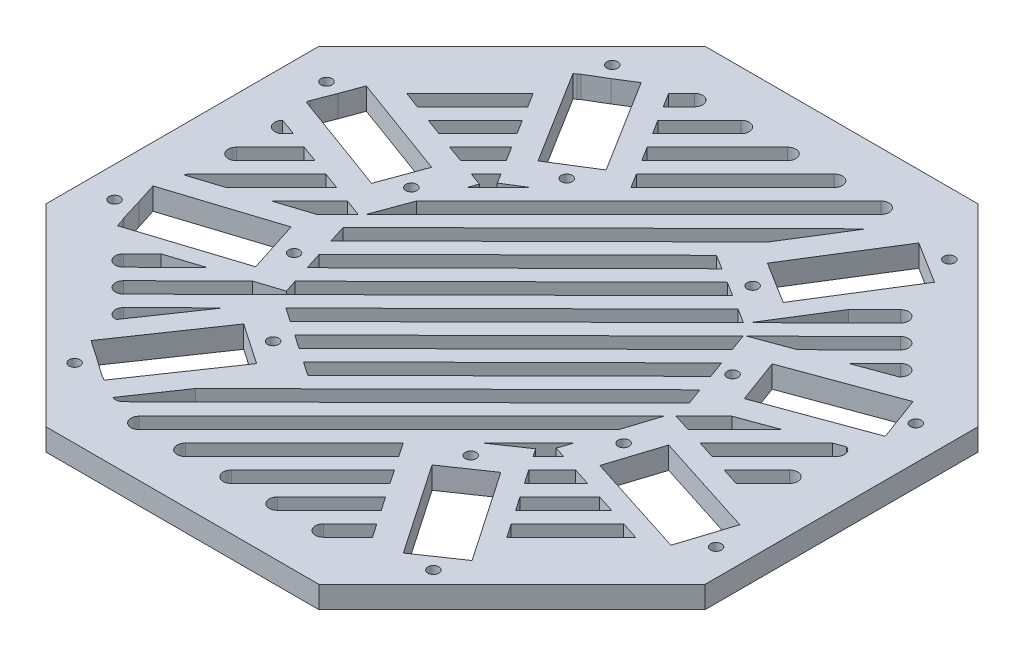
from build123d import *

# Parameters (mm, degrees)
SKETCH_R            = 1
BOSS_EXTRUDE2_DEPTH = 4
BOSS_EXTRUDE3_DEPTH = 4
BOSS_EXTRUDE4_DEPTH = 4
BOSS_EXTRUDE5_DEPTH = 4


with BuildPart() as part:
    # Sketch → Boss-Extrude2 (new body)
    with BuildSketch(Plane(origin=(0, 0, 0), x_dir=(1, 0, 0), z_dir=(0, 1, 0))):
        Polygon((24.852813742, -60), (60, -24.852813742), (60, 24.852813742), (24.852813742, 60), (-24.852813742, 60), (-60, 24.852813742), (-60, -24.852813742), (-24.852813742, -60), align=None)
        with BuildLine():
            ThreePointArc((15.547632792, 51.610078632), (17.668953135, 51.610078632), (17.668953135, 49.488758289))
            Line((17.668953135, 49.488758289), (-29.181889622, 2.637915532))
            Line((-29.181889622, 2.637915532), (-26.726613217, 9.335832623))
            Line((-26.726613217, 9.335832623), (15.547632792, 51.610078632))
        make_face(mode=Mode.SUBTRACT)
        Polygon((-18.457469949, 21.847616579), (-24.271336813, 16.033749714), (-23.651997277, 17.723288562), (-25.973454736, 18.574272479), (-23.289921125, 21.25780609), (-22.199833785, 19.511517433), align=None, mode=Mode.SUBTRACT)
        with BuildLine():
            Line((9.183671761, 49.488758289), (-9.321050806, 30.984035722))
            Line((-9.321050806, 30.984035722), (-10.951599402, 33.596127812))
            Line((-10.951599402, 33.596127812), (7.062351417, 51.610078632))
            ThreePointArc((7.062351417, 51.610078632), (9.183671761, 51.610078632), (9.183671761, 49.488758289))
        make_face(mode=Mode.SUBTRACT)
        with BuildLine():
            Line((0.698390387, 49.488758289), (-12.582147999, 36.208219903))
            Line((-12.582147999, 36.208219903), (-14.212696595, 38.820311994))
            Line((-14.212696595, 38.820311994), (-1.422929957, 51.610078632))
            ThreePointArc((-1.422929957, 51.610078632), (0.698390387, 51.610078632), (0.698390387, 49.488758289))
        make_face(mode=Mode.SUBTRACT)
        with BuildLine():
            Line((-7.786890987, 49.488758289), (-18.746379715, 38.529269561))
            Line((-18.746379715, 38.529269561), (-14.349223836, 31.485151945))
            Line((-14.349223836, 31.485151945), (-21.98384641, 26.719384625))
            Line((-21.98384641, 26.719384625), (-32.574440455, 43.685212567))
            Line((-32.574440455, 43.685212567), (-32.145121214, 43.953206903))
            Line((-32.145121214, 43.953206903), (-31.759627251, 44.281125154))
            Line((-31.759627251, 44.281125154), (-28.330410334, 46.33446731))
            Line((-28.330410334, 46.33446731), (-24.939817881, 48.450979888))
            Line((-24.939817881, 48.450979888), (-20.376928311, 41.141361652))
            Line((-20.376928311, 41.141361652), (-9.908211331, 51.610078632))
            ThreePointArc((-9.908211331, 51.610078632), (-7.786890987, 51.610078632), (-7.786890987, 49.488758289))
        make_face(mode=Mode.SUBTRACT)
        with BuildLine():
            Line((-16.272172362, 49.488758289), (-19.104342385, 46.656588265))
            Line((-19.104342385, 46.656588265), (-20.734890981, 49.268680356))
            Line((-20.734890981, 49.268680356), (-18.393492705, 51.610078632))
            ThreePointArc((-18.393492705, 51.610078632), (-16.272172362, 51.610078632), (-16.272172362, 49.488758289))
        make_face(mode=Mode.SUBTRACT)
        with BuildLine():
            Line((-23.386884958, -49.297198938), (-17.265542524, -40.337796786))
            Line((-17.265542524, -40.337796786), (28.858580089, 5.368255674))
            Line((28.858580089, 5.368255674), (29.994252328, 2.270177395))
            Line((29.994252328, 2.270177395), (-21.732188811, -48.987414041))
            ThreePointArc((-21.732188811, -48.987414041), (-22.511981545, -49.396320284), (-23.386884958, -49.297198938))
        make_face(mode=Mode.SUBTRACT)
        with BuildLine():
            ThreePointArc((-15.920221348, -51.966319523), (-18.035989196, -51.966319523), (-18.035989196, -49.850551674))
            Line((-18.035989196, -49.850551674), (29.735518609, -2.079043869))
            Line((29.735518609, -2.079043869), (27.74095069, -8.305147485))
            Line((27.74095069, -8.305147485), (-15.920221348, -51.966319523))
        make_face(mode=Mode.SUBTRACT)
        with BuildLine():
            ThreePointArc((17.847543234, -52.154981783), (15.72622289, -52.154981783), (15.72622289, -50.033661439))
            Line((15.72622289, -50.033661439), (20.576321038, -45.183563292))
            Line((20.576321038, -45.183563292), (22.298428081, -47.704096936))
            Line((22.298428081, -47.704096936), (17.847543234, -52.154981783))
        make_face(mode=Mode.SUBTRACT)
        with Locations((-29.313955478, 10.994083497)):
            Circle(SKETCH_R, mode=Mode.SUBTRACT)
        with Locations((-16.577946016, 26.557394094)):
            Circle(SKETCH_R, mode=Mode.SUBTRACT)
        Polygon((-29.237090611, -1.51987861), (18.657229481, 45.940326216), (11.745261483, 34.867551704), (-28.210101751, -4.725655158), align=None, mode=Mode.SUBTRACT)
        Polygon((-29.909052339, 1.910752815), (-33.685692162, -1.865887009), (-39.928135193, -3.865689353), (-33.013636065, 3.048809775), align=None, mode=Mode.SUBTRACT)
        with Locations((-30.345718275, 48.612970419)):
            Circle(SKETCH_R, mode=Mode.SUBTRACT)
        Polygon((-44.600957094, 25.402614244), (-33.073212704, 36.930358634), (-31.442664107, 34.318266543), (-41.496373368, 24.264557283), align=None, mode=Mode.SUBTRACT)
        Polygon((-49.440228376, 22.916277755), (-30.662134393, 16.032733147), (-33.599204758, 8.02049723), (-52.377298741, 14.904041837), (-52.363635773, 14.941313985), (-52.260838429, 15.436862853), (-50.8158933, 19.163506953), align=None, mode=Mode.SUBTRACT)
        with Locations((-53.725477656, 19.942691487)):
            Circle(SKETCH_R, mode=Mode.SUBTRACT)
        with BuildLine():
            Line((-51.610078632, -7.062351417), (-39.222803518, 5.324923697))
            Line((-39.222803518, 5.324923697), (-36.118219791, 4.186866736))
            Line((-36.118219791, 4.186866736), (-46.170578225, -5.865491697))
            Line((-46.170578225, -5.865491697), (-51.997617193, -7.732216973))
            ThreePointArc((-51.997617193, -7.732216973), (-51.847791756, -7.371861282), (-51.610078632, -7.062351417))
        make_face(mode=Mode.SUBTRACT)
        with BuildLine():
            ThreePointArc((-49.488758289, -0.698390387), (-51.610078632, -0.698390387), (-51.610078632, 1.422929957))
            Line((-51.610078632, 1.422929957), (-45.43197097, 7.601037619))
            Line((-45.43197097, 7.601037619), (-42.327387244, 6.462980658))
            Line((-42.327387244, 6.462980658), (-49.488758289, -0.698390387))
        make_face(mode=Mode.SUBTRACT)
        with BuildLine():
            ThreePointArc((-49.488758289, 7.786890987), (-51.594538912, 7.771575675), (-51.640481608, 9.876910769))
            Line((-51.640481608, 9.876910769), (-48.536554697, 8.739094579))
            Line((-48.536554697, 8.739094579), (-49.488758289, 7.786890987))
        make_face(mode=Mode.SUBTRACT)
        Polygon((-53.09075613, -12.282653686), (-34.044240872, -6.18099354), (-30.998587022, -15.688093434), (-50.045102279, -21.78975358), (-50.499411202, -20.371614646), (-50.722662067, -19.917417524), (-51.871349514, -16.089068033), align=None, mode=Mode.SUBTRACT)
        with Locations((-54.424906493, -17.951452655)):
            Circle(SKETCH_R, mode=Mode.SUBTRACT)
        with BuildLine():
            Line((-40.814392402, -29.885895415), (-29.055540278, -18.233625808))
            Line((-29.055540278, -18.233625808), (-24.3642072, -16.730730413))
            Line((-24.3642072, -16.730730413), (-25.12917774, -14.342851915))
            Line((-25.12917774, -14.342851915), (14.384729777, 24.812900598))
            Line((14.384729777, 24.812900598), (16.999603088, 23.180615877))
            Line((16.999603088, 23.180615877), (-38.70275156, -32.016851293))
            ThreePointArc((-38.70275156, -32.016851293), (-40.82404992, -32.007193775), (-40.814392402, -29.885895415))
        make_face(mode=Mode.SUBTRACT)
        Polygon((-21.739006454, -19.4302352), (19.614422203, 21.548364988), (22.229295514, 19.916080268), (-19.216285307, -21.153836814), align=None, mode=Mode.SUBTRACT)
        with BuildLine():
            Line((-36.571751715, -34.128536102), (-27.407885848, -25.047731735))
            Line((-27.407885848, -25.047731735), (-35.359392435, -36.685823541))
            ThreePointArc((-35.359392435, -36.685823541), (-36.871330347, -35.836581863), (-36.571751715, -34.128536102))
        make_face(mode=Mode.SUBTRACT)
        with BuildLine():
            Line((-45.057033089, -25.643254728), (-41.651834198, -22.268920642))
            Line((-41.651834198, -22.268920642), (-35.353621969, -20.251252315))
            Line((-35.353621969, -20.251252315), (-42.945392247, -27.774210606))
            ThreePointArc((-42.945392247, -27.774210606), (-45.066690607, -27.764553088), (-45.057033089, -25.643254728))
        make_face(mode=Mode.SUBTRACT)
        Polygon((-34.351904297, -42.301756928), (-23.069244775, -25.788077928), (-15.638089225, -30.865274713), (-26.920748747, -47.378953713), (-27.338626386, -47.093446702), (-27.793776335, -46.872144874), (-31.051673057, -44.556577639), align=None, mode=Mode.SUBTRACT)
        with Locations((-32.32872545, -47.31740717)):
            Circle(SKETCH_R, mode=Mode.SUBTRACT)
        Polygon((30.85538164, -0.959180838), (35.933840849, 4.119278371), (42.614226335, 6.56812816), (34.06022684, -1.985871336), align=None, mode=Mode.SUBTRACT)
        Polygon((17.547499239, -22.756933339), (25.733750988, -14.570681589), (24.978702676, -16.927587555), (26.978756896, -17.568316368), (24.197771941, -20.349301324), (23.202813421, -18.893046654), align=None, mode=Mode.SUBTRACT)
        with BuildLine():
            Line((-9.589856533, -49.894289111), (10.243838043, -30.060594535))
            Line((10.243838043, -30.060594535), (11.965945086, -32.581128179))
            Line((11.965945086, -32.581128179), (-7.46853619, -52.015609454))
            ThreePointArc((-7.46853619, -52.015609454), (-9.589856533, -52.015609454), (-9.589856533, -49.894289111))
        make_face(mode=Mode.SUBTRACT)
        with BuildLine():
            Line((-1.151163392, -49.940746554), (13.687999041, -35.101584121))
            Line((13.687999041, -35.101584121), (15.410106084, -37.622117764))
            Line((15.410106084, -37.622117764), (0.970156952, -52.062066897))
            ThreePointArc((0.970156952, -52.062066897), (-1.151163392, -52.062066897), (-1.151163392, -49.940746554))
        make_face(mode=Mode.SUBTRACT)
        with BuildLine():
            Line((7.287529749, -49.987203996), (17.132160039, -40.142573707))
            Line((17.132160039, -40.142573707), (18.854267083, -42.66310735))
            Line((18.854267083, -42.66310735), (9.408850093, -52.10852434))
            ThreePointArc((9.408850093, -52.10852434), (7.287529749, -52.10852434), (7.287529749, -49.987203996))
        make_face(mode=Mode.SUBTRACT)
        with Locations((33.006285238, -47.31740717)):
            Circle(SKETCH_R, mode=Mode.SUBTRACT)
        Polygon((27.598308535, -47.378953713), (16.315649013, -30.865274713), (23.746804563, -25.788077928), (35.029464085, -42.301756928), align=None, mode=Mode.SUBTRACT)
        with Locations((31.023278063, 48.612970419)):
            Circle(SKETCH_R, mode=Mode.SUBTRACT)
        with BuildLine():
            Line((33.252000243, 43.685212567), (31.523180705, 40.915693247))
            ThreePointArc((31.523180705, 40.915693247), (32.703276967, 39.88957747), (32.329111028, 38.371176789))
            Line((32.329111028, 38.371176789), (26.051906693, 32.150869185))
            Line((26.051906693, 32.150869185), (22.661406198, 26.719384625))
            Line((22.661406198, 26.719384625), (15.026783624, 31.485151945))
            Line((15.026783624, 31.485151945), (25.617377669, 48.450979888))
            Line((25.617377669, 48.450979888), (33.252000243, 43.685212567))
        make_face(mode=Mode.SUBTRACT)
        Polygon((-24.920469721, 23.869898181), (-29.078038462, 19.71232944), (-32.182622189, 20.8503864), (-26.551018318, 26.481990271), align=None, mode=Mode.SUBTRACT)
        Polygon((34.276764546, 8.02049723), (31.339694181, 16.032733147), (50.117788164, 22.916277755), (53.054858529, 14.904041837), align=None, mode=Mode.SUBTRACT)
        with Locations((30.341996447, -10.019294465)):
            Circle(SKETCH_R, mode=Mode.SUBTRACT)
        with Locations((18.33882786, -25.849624471)):
            Circle(SKETCH_R, mode=Mode.SUBTRACT)
        Polygon((-26.156145315, -11.137141811), (-27.183134176, -7.931365263), (9.155037352, 28.077436207), (11.769910663, 26.445151487), align=None, mode=Mode.SUBTRACT)
        with Locations((-29.664436659, -10.019294465)):
            Circle(SKETCH_R, mode=Mode.SUBTRACT)
        with BuildLine():
            Line((36.571751715, 34.128536102), (22.814148734, 20.495632364))
            Line((22.814148734, 20.495632364), (29.726116733, 31.568406876))
            Line((29.726116733, 31.568406876), (34.460110873, 36.25949198))
            ThreePointArc((34.460110873, 36.25949198), (36.581409233, 36.249834462), (36.571751715, 34.128536102))
        make_face(mode=Mode.SUBTRACT)
        with BuildLine():
            Line((45.057033089, 25.643254728), (44.939384704, 25.52667271))
            Line((44.939384704, 25.52667271), (38.174957969, 23.047015658))
            Line((38.174957969, 23.047015658), (42.945392247, 27.774210606))
            ThreePointArc((42.945392247, 27.774210606), (45.066690607, 27.764553088), (45.057033089, 25.643254728))
        make_face(mode=Mode.SUBTRACT)
        with BuildLine():
            Line((40.814392402, 29.885895415), (31.410671434, 20.56741))
            Line((31.410671434, 20.56741), (24.646244699, 18.087752947))
            Line((24.646244699, 18.087752947), (38.70275156, 32.016851293))
            ThreePointArc((38.70275156, 32.016851293), (40.82404992, 32.007193775), (40.814392402, 29.885895415))
        make_face(mode=Mode.SUBTRACT)
        Polygon((-16.693616445, -22.877402704), (24.315938212, 17.760440366), (25.45161045, 14.662362087), (-14.170895298, -24.601004319), align=None, mode=Mode.SUBTRACT)
        with Locations((17.255505804, 26.557394094)):
            Circle(SKETCH_R, mode=Mode.SUBTRACT)
        with Locations((-17.661268072, -25.849624471)):
            Circle(SKETCH_R, mode=Mode.SUBTRACT)
        Polygon((27.722931389, 8.466269741), (-9.125505289, -28.048171823), (-11.648226436, -26.324570209), (26.587259151, 11.56434802), align=None, mode=Mode.SUBTRACT)
        with BuildLine():
            Line((40.498624423, -4.048448842), (37.285368619, -3.019063959))
            Line((37.285368619, -3.019063959), (49.336919317, 9.03248674))
            Line((49.336919317, 9.03248674), (51.204955733, 9.717258688))
            ThreePointArc((51.204955733, 9.717258688), (52.183493658, 8.637454392), (51.783322239, 7.236248975))
            Line((51.783322239, 7.236248975), (40.498624423, -4.048448842))
        make_face(mode=Mode.SUBTRACT)
        with BuildLine():
            Line((34.721800661, -6.18099354), (53.768315918, -12.282653686))
            Line((53.768315918, -12.282653686), (52.221873782, -17.109919221))
            ThreePointArc((52.221873782, -17.109919221), (52.151150712, -17.616167117), (51.914539677, -18.069271855))
            Line((51.914539677, -18.069271855), (50.722662067, -21.78975358))
            Line((50.722662067, -21.78975358), (31.67614681, -15.688093434))
            Line((31.67614681, -15.688093434), (34.721800661, -6.18099354))
        make_face(mode=Mode.SUBTRACT)
        Polygon((25.919825896, -22.869757266), (30.191913643, -18.597669518), (33.405169447, -19.627054401), (27.641932939, -25.39029091), align=None, mode=Mode.SUBTRACT)
        with Locations((53.80574001, 19.7237383)):
            Circle(SKETCH_R, mode=Mode.SUBTRACT)
        Polygon((46.25799455, -23.744530467), (34.530254936, -35.472270081), (32.808147893, -32.951736437), (43.044738746, -22.715145584), align=None, mode=Mode.SUBTRACT)
        with Locations((55.102466281, -17.951452655)):
            Circle(SKETCH_R, mode=Mode.SUBTRACT)
        with BuildLine():
            ThreePointArc((50.378292836, -7.213457149), (51.180286578, -7.244903378), (51.851260832, -7.685330875))
            Line((51.851260832, -7.685330875), (50.378292836, -7.213457149))
        make_face(mode=Mode.SUBTRACT)
        with BuildLine():
            Line((51.783322239, -1.248901609), (46.925036974, -6.107186875))
            Line((46.925036974, -6.107186875), (43.71178117, -5.077801992))
            Line((43.71178117, -5.077801992), (49.662001896, 0.872418734))
            ThreePointArc((49.662001896, 0.872418734), (51.783322239, 0.872418734), (51.783322239, -1.248901609))
        make_face(mode=Mode.SUBTRACT)
        Polygon((-29.812115511, 31.706174452), (-28.181566914, 29.094082362), (-35.287205915, 21.988443361), (-38.391789641, 23.126500322), align=None, mode=Mode.SUBTRACT)
        with Locations((29.394217832, 10.77513031)):
            Circle(SKETCH_R, mode=Mode.SUBTRACT)
        Polygon((31.086093937, -30.431280495), (29.363986894, -27.910746852), (36.618326195, -20.656407551), (39.831581999, -21.685792434), align=None, mode=Mode.SUBTRACT)
    extrude(amount=BOSS_EXTRUDE2_DEPTH)

    # Sketch<4> → Boss-Extrude3 (add)
    with BuildSketch(Plane(origin=(0, 0, 0), x_dir=(1, 0, 0), z_dir=(0, 1, 0))):
        with BuildLine():
            ThreePointArc((32.329111028, 38.371176789), (32.703276967, 39.88957747), (31.523180705, 40.915693247))
            Line((31.523180705, 40.915693247), (26.051906693, 32.150869185))
            Line((26.051906693, 32.150869185), (32.329111028, 38.371176789))
        make_face()
        with BuildLine():
            Line((50.378292836, -7.213457149), (51.851260832, -7.685330875))
            ThreePointArc((51.851260832, -7.685330875), (51.180286578, -7.244903378), (50.378292836, -7.213457149))
        make_face()
    extrude(amount=BOSS_EXTRUDE3_DEPTH)

    # Sketch<5> → Boss-Extrude4 (add)
    with BuildSketch(Plane(origin=(0, 0, 0), x_dir=(1, 0, 0), z_dir=(0, 1, 0))):
        Polygon((-15.843245192, 41.432404084), (-17.473793788, 44.044496175), (-20.376928311, 41.141361652), (-18.746379715, 38.529269561), align=None)
    extrude(amount=BOSS_EXTRUDE4_DEPTH)

    # Sketch<6> → Boss-Extrude5 (add)
    with BuildSketch(Plane(origin=(0, 0, 0), x_dir=(1, 0, 0), z_dir=(0, 1, 0))):
        with BuildLine():
            ThreePointArc((51.914539677, -18.069271855), (52.151150712, -17.616167117), (52.221873782, -17.109919221))
            Line((52.221873782, -17.109919221), (51.914539677, -18.069271855))
        make_face()
    extrude(amount=BOSS_EXTRUDE5_DEPTH)


solid = part.part
